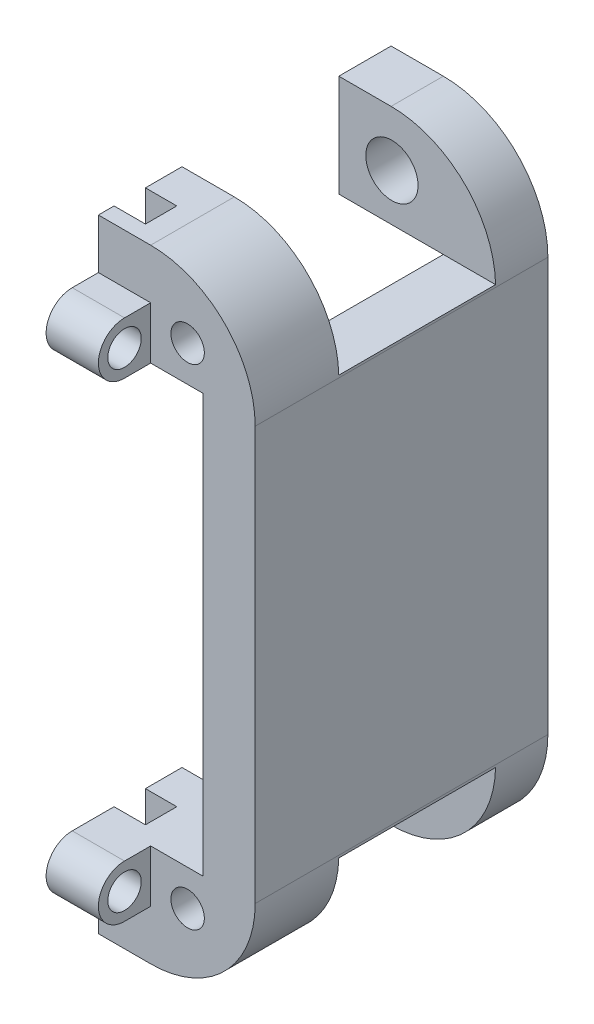
from build123d import *
from build123d.topology import SkipClean

# Parameters (mm, degrees)
BOSS_EXTRUDE1_DEPTH = 8
SKETCH2_W           = 20
SKETCH2_H           = 40
BOSS_EXTRUDE2_DEPTH = 5
SKETCH3_W           = 5
SKETCH3_H           = 5
BOSS_EXTRUDE3_DEPTH = 5
FILLET2_RADIUS      = 2.5
FILLET2_LENGTH      = 5
FILLET3_RADIUS      = 2.5
FILLET3_LENGTH      = 5
SKETCH6_R           = 1.6
CUT_EXTRUDE3_DEPTH  = 34.541019662
BOSS_EXTRUDE4_DEPTH = 5
BOSS_EXTRUDE5_DEPTH = 5
SKETCH11_W          = 15
SKETCH11_H          = 4.771622141
BOSS_EXTRUDE6_DEPTH = 8
FILLET4_R           = 10
FILLET5_START       = -21
FILLET5_DEPTH       = 30
SKETCH12_R          = 1.6
CUT_EXTRUDE4_DEPTH  = 10
SKETCH15_W          = 6
SKETCH15_H          = 3
CUT_EXTRUDE7_DEPTH  = 20
SKETCH17_W          = 6
SKETCH17_H          = 3
CUT_EXTRUDE8_DEPTH  = 20


with BuildPart() as part:
    # Sketch1 → Boss-Extrude1 (new body)
    with BuildSketch(Plane.XY):
        Polygon((-5, 25), (10, 25), (10, -25), (-5, -25), (-5, -20), (5, -20), (5, 20), (-5, 20), align=None)
    extrude(amount=BOSS_EXTRUDE1_DEPTH)

    # Sketch2 → Boss-Extrude2 (add)
    with BuildSketch(Plane(origin=(10, 0, 0), x_dir=(0, 0, -1), z_dir=(1, 0, 0))):
        with Locations((10, 0)):
            Rectangle(SKETCH2_W, SKETCH2_H)
    extrude(amount=-BOSS_EXTRUDE2_DEPTH)

    # Sketch3 → Boss-Extrude3 (add)
    with BuildSketch(Plane.XY.offset(8)):
        with Locations((-2.5, 22.5)):
            Rectangle(SKETCH3_W, SKETCH3_H)
        with Locations((-2.5, -22.5)):
            Rectangle(SKETCH3_W, SKETCH3_H)
    extrude(amount=BOSS_EXTRUDE3_DEPTH)

    # Fillet2: full round fillet: the end face becomes a half cylinder, R = half its width
    fillet2_face = Plane((-2.5, 22.5, 13), x_dir=(1, 0, 0), z_dir=(0, 0, 1))  # on the end face: x along it, z out of the body
    fillet2_slab = fillet2_face.offset(-FILLET2_RADIUS / 2) * Box(FILLET2_LENGTH, 2 * FILLET2_RADIUS, FILLET2_RADIUS, mode=Mode.PRIVATE)  # the body's end, R deep
    fillet2_round = Plane((-2.5, 22.5, 10.5), x_dir=(0, 0, 1), z_dir=(1, 0, 0)) * Cylinder(FILLET2_RADIUS, FILLET2_LENGTH, mode=Mode.PRIVATE)  # its axis R under the face
    add(fillet2_slab - fillet2_round, mode=Mode.SUBTRACT)

    # Fillet3: full round fillet: the end face becomes a half cylinder, R = half its width
    fillet3_face = Plane((-2.5, -22.5, 13), x_dir=(1, 0, 0), z_dir=(0, 0, 1))  # on the end face: x along it, z out of the body
    fillet3_slab = fillet3_face.offset(-FILLET3_RADIUS / 2) * Box(FILLET3_LENGTH, 2 * FILLET3_RADIUS, FILLET3_RADIUS, mode=Mode.PRIVATE)  # the body's end, R deep
    fillet3_round = Plane((-2.5, -22.5, 10.5), x_dir=(0, 0, 1), z_dir=(1, 0, 0)) * Cylinder(FILLET3_RADIUS, FILLET3_LENGTH, mode=Mode.PRIVATE)  # its axis R under the face
    add(fillet3_slab - fillet3_round, mode=Mode.SUBTRACT)

    # Sketch6 → Cut-Extrude3 (cut, through all)
    with BuildSketch(Plane(origin=(0, 0, 0), x_dir=(0, 0, -1), z_dir=(1, 0, 0))):
        with Locations((-10.5, 22.5)):
            Circle(SKETCH6_R)
        with Locations((-10.5, -22.5)):
            Circle(SKETCH6_R)
    extrude(amount=-CUT_EXTRUDE3_DEPTH, mode=Mode.SUBTRACT)

    # Sketch7 → Boss-Extrude4 (add)
    with BuildSketch(Plane(origin=(0, 0, -20), x_dir=(-1, 0, 0), z_dir=(0, 0, -1))):
        with BuildLine():
            Line((5, 27.3), (5, 20))
            Line((5, 20), (-5, 20))
            Line((-5, 20), (-10, 20))
            Line((-10, 20), (-10, 27.3))
            Line((-10, 27.3), (-1.58, 27.3))
            Line((-1.58, 27.3), (-1.58, 26.5))
            ThreePointArc((-1.58, 26.5), (-0.08, 22), (1.42, 26.5))
            Line((1.42, 26.5), (1.42, 27.3))
            Line((1.42, 27.3), (5, 27.3))
        make_face()
    boss_extrude4 = extrude(amount=-BOSS_EXTRUDE4_DEPTH)

    # Mirror3: Boss-Extrude4 across plane
    add(boss_extrude4.mirror(Plane.ZX))

    # Sketch10 → Boss-Extrude5 (add)
    with SkipClean():  # the faces are left unmerged after this step: merging them gives an invalid solid
        with BuildSketch(Plane(origin=(0, 0, -20), x_dir=(-1, 0, 0), z_dir=(0, 0, -1))):
            with BuildLine():
                Line((5, 29.771622141), (-10, 29.771622141))
                Line((-10, 29.771622141), (-10, 27.3))
                Line((-10, 27.3), (-1.58, 27.3))
                Line((-1.58, 27.3), (-1.58, 26.5))
                ThreePointArc((-1.58, 26.5), (-0.08, 27), (1.42, 26.5))
                Line((1.42, 26.5), (1.42, 27.3))
                Line((1.42, 27.3), (5, 27.3))
                Line((5, 27.3), (5, 29.771622141))
            make_face()
        boss_extrude5 = extrude(amount=-BOSS_EXTRUDE5_DEPTH)

    # Mirror4: Boss-Extrude5 across plane
    with SkipClean():  # the faces are left unmerged after this step: merging them gives an invalid solid
        add(boss_extrude5.mirror(Plane.ZX))

    # Sketch11 → Boss-Extrude6 (add)
    with SkipClean():  # the faces are left unmerged after this step: merging them gives an invalid solid
        with BuildSketch(Plane.XY.offset(8)):
            with Locations((2.5, 27.385811071)):
                Rectangle(SKETCH11_W, SKETCH11_H)
            with Locations((2.5, -27.385811071)):
                Rectangle(SKETCH11_W, SKETCH11_H)
        extrude(amount=-BOSS_EXTRUDE6_DEPTH)

    # Fillet4
    # the kernel refuses this fillet: 10 mm, written as the material it takes off along each edge
    with BuildSketch(Plane(origin=(10, 29.771622141, 33), x_dir=(0, -1, 0), z_dir=(0, 0, -1))) as fillet4_piece_1:
        with BuildLine():
            CenterArc((FILLET4_R, FILLET4_R), FILLET4_R, 180, 90)
            Line((0, FILLET4_R), (0, 0))
            Line((0, 0), (FILLET4_R, 0))
        make_face()
    extrude(amount=58, mode=Mode.SUBTRACT)

    # Fillet5: read off the stored shape, not the designer's step
    # Fillet5 outline → Fillet5 (cut)
    with BuildSketch(Plane.XY.offset(FILLET5_START)):
        with BuildLine():
            Line((10, -29.771622141), (10, -19.771622141))
            ThreePointArc((10, -19.771622141), (7.071067812, -26.842689953), (0, -29.771622141))
            Line((0, -29.771622141), (10, -29.771622141))
        make_face()
    extrude(amount=FILLET5_DEPTH, mode=Mode.SUBTRACT)

    # Sketch12 → Cut-Extrude4 (cut)
    with BuildSketch(Plane.XY.offset(8)):
        with Locations((3.535533906, 23.421344977)):
            Circle(SKETCH12_R)
        with Locations((3.535533906, -23.421344977)):
            Circle(SKETCH12_R)
    extrude(amount=-CUT_EXTRUDE4_DEPTH, mode=Mode.SUBTRACT)

    # Sketch15 → Cut-Extrude7 (cut)
    with BuildSketch(Plane.XZ.offset(29.771622141)):
        with Locations((-5, 5)):
            Rectangle(SKETCH15_W, SKETCH15_H)
    extrude(amount=-CUT_EXTRUDE7_DEPTH, mode=Mode.SUBTRACT)

    # Sketch17 → Cut-Extrude8 (cut)
    with BuildSketch(Plane(origin=(0, 29.771622141, 0), x_dir=(1, 0, 0), z_dir=(0, 1, 0))):
        with Locations((-5, -5)):
            Rectangle(SKETCH17_W, SKETCH17_H)
    extrude(amount=-CUT_EXTRUDE8_DEPTH, mode=Mode.SUBTRACT)


solid = part.part
